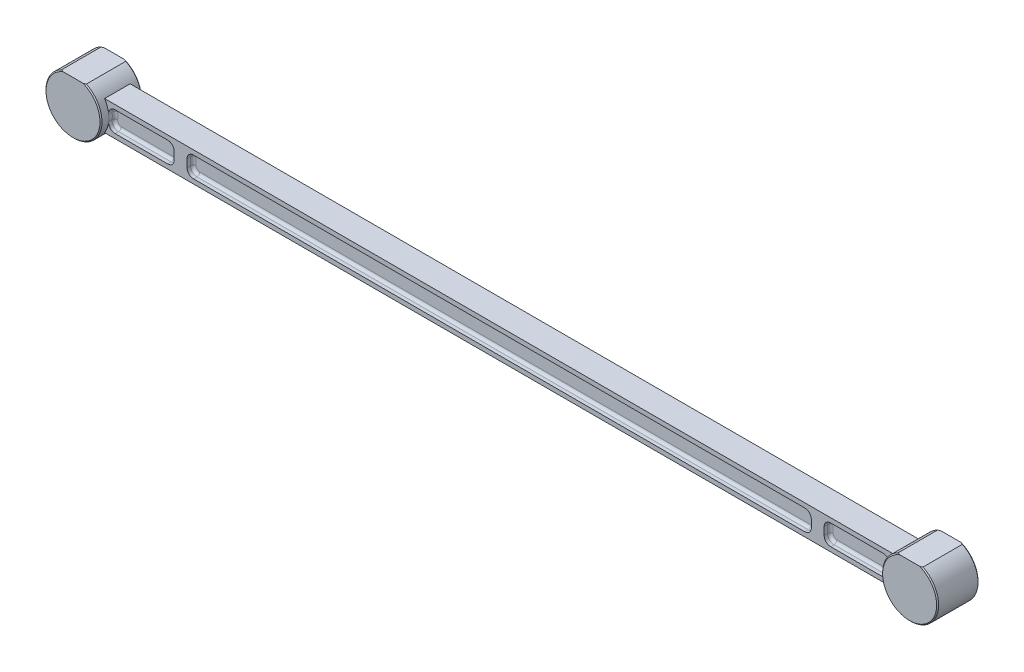
from build123d import *
from build123d.topology import SkipClean

# Parameters (mm, degrees)
EXTRUDE1_DEPTH      = 19.812
EXTRUDE1_DEPTH_BACK = 19.812
CUT_EXTRUDE1_DEPTH  = 9.652
CUT_EXTRUDE2_START  = -9.652
CUT_EXTRUDE2_DEPTH  = 9.652
EXTRUDE2_DEPTH      = 12.192
EXTRUDE2_DEPTH_BACK = 52.07
CHAMFER1_SIZE       = 1.524
FILLET1_R           = 4.318


with BuildPart() as part:
    # Sketch3 → Extrude1 (new, two sides: drawn at the far end of the back side and taken through both)
    with BuildSketch(Plane.XY.offset(-EXTRUDE1_DEPTH_BACK)):
        with BuildLine():
            Line((-19.262201877, 39.000001091), (19.262201877, 39.000001091))
            ThreePointArc((19.262201877, 39.000001091), (29.207695203, 32.232639469), (36.919270155, 22.999999944))
            Line((36.919270155, 22.999999944), (1263.080729845, 22.999999944))
            ThreePointArc((1263.080729845, 22.999999944), (1270.792304797, 32.232639469), (1280.737798123, 39.000001091))
            Line((1280.737798123, 39.000001091), (1319.262201877, 39.000001091))
            ThreePointArc((1319.262201877, 39.000001091), (1332.232639491, -29.207695179), (1263.080729879, -23))
            Line((1263.080729879, -23), (36.919270121, -23))
            ThreePointArc((36.919270121, -23), (-32.232639491, -29.207695179), (-19.262201877, 39.000001091))
        make_face()
    extrude(amount=EXTRUDE1_DEPTH + EXTRUDE1_DEPTH_BACK)

    # Sketch4 → Cut-Extrude1 (cut)
    with BuildSketch(Plane.XY.offset(19.812)):
        with BuildLine():
            Line((53.16249, 15.999999944), (134.999999965, 15.999999944))
            ThreePointArc((134.999999965, 15.999999944), (142.07106777, 13.071067778), (145, 6))
            Line((145, 6), (145, -6))
            ThreePointArc((145, -6), (142.071067812, -13.071067812), (135, -16))
            Line((135, -16), (53.16249, -16))
            ThreePointArc((53.16249, -16), (45.705450362, -12.662765822), (43.22557716, -4.878499573))
            ThreePointArc((43.22557716, -4.878499573), (43.500001722, 5.034e-06), (43.225576025, 4.878509576))
            ThreePointArc((43.225576025, 4.878509576), (45.705449579, 12.662773253), (53.16249, 15.999999944))
        make_face()
        with BuildLine():
            Line((165, 6), (165, -6))
            ThreePointArc((165, -6), (167.928932188, -13.071067812), (175, -16))
            Line((175, -16), (1124.999999965, -16))
            ThreePointArc((1124.999999965, -16), (1132.071067777, -13.071067812), (1134.999999965, -6))
            Line((1134.999999965, -6), (1134.999999965, 6))
            ThreePointArc((1134.999999965, 6), (1132.071067777, 13.071067812), (1124.999999965, 16))
            Line((1124.999999965, 16), (175, 16))
            ThreePointArc((175, 16), (167.928932188, 13.071067812), (165, 6))
        make_face()
        with BuildLine():
            Line((1164.999999965, -16), (1246.837509965, -16))
            ThreePointArc((1246.837509965, -16), (1254.294549604, -12.662765822), (1256.774422805, -4.878499573))
            ThreePointArc((1256.774422805, -4.878499573), (1256.499998243, 5.034e-06), (1256.774423941, 4.878509576))
            ThreePointArc((1256.774423941, 4.878509576), (1254.294550386, 12.662773253), (1246.837509965, 15.999999944))
            Line((1246.837509965, 15.999999944), (1165, 15.999999944))
            ThreePointArc((1165, 15.999999944), (1157.928932195, 13.071067778), (1154.999999965, 6))
            Line((1154.999999965, 6), (1154.999999965, -6))
            ThreePointArc((1154.999999965, -6), (1157.928932153, -13.071067812), (1164.999999965, -16))
        make_face()
    extrude(amount=-CUT_EXTRUDE1_DEPTH, mode=Mode.SUBTRACT)

    # Sketch5 → Cut-Extrude2 (cut)
    with BuildSketch(Plane(origin=(0, 0, -19.812), x_dir=(-1, 0, 0), z_dir=(0, 0, -1)).offset(CUT_EXTRUDE2_START)):
        with BuildLine():
            Line((-165, -6), (-165, 6))
            ThreePointArc((-165, 6), (-167.928932188, 13.071067812), (-175, 16))
            Line((-175, 16), (-1124.999999965, 16))
            ThreePointArc((-1124.999999965, 16), (-1132.071067777, 13.071067812), (-1134.999999965, 6))
            Line((-1134.999999965, 6), (-1134.999999965, -6))
            ThreePointArc((-1134.999999965, -6), (-1132.071067777, -13.071067812), (-1124.999999965, -16))
            Line((-1124.999999965, -16), (-175, -16))
            ThreePointArc((-175, -16), (-167.928932188, -13.071067812), (-165, -6))
        make_face()
        with BuildLine():
            Line((-1165, 15.999999944), (-1246.837509965, 15.999999944))
            ThreePointArc((-1246.837509965, 15.999999944), (-1254.294550386, 12.662773253), (-1256.774423941, 4.878509576))
            ThreePointArc((-1256.774423941, 4.878509576), (-1256.499998243, 5.034e-06), (-1256.774422805, -4.878499573))
            ThreePointArc((-1256.774422805, -4.878499573), (-1254.294549604, -12.662765822), (-1246.837509965, -16))
            Line((-1246.837509965, -16), (-1164.999999965, -16))
            ThreePointArc((-1164.999999965, -16), (-1157.928932153, -13.071067812), (-1154.999999965, -6))
            Line((-1154.999999965, -6), (-1154.999999965, 6))
            ThreePointArc((-1154.999999965, 6), (-1157.928932195, 13.071067778), (-1165, 15.999999944))
        make_face()
        with BuildLine():
            Line((-135, -16), (-53.16249, -16))
            ThreePointArc((-53.16249, -16), (-45.705450362, -12.662765822), (-43.22557716, -4.878499573))
            ThreePointArc((-43.22557716, -4.878499573), (-43.500001722, 5.034e-06), (-43.225576025, 4.878509576))
            ThreePointArc((-43.225576025, 4.878509576), (-45.705449579, 12.662773253), (-53.16249, 15.999999944))
            Line((-53.16249, 15.999999944), (-134.999999965, 15.999999944))
            ThreePointArc((-134.999999965, 15.999999944), (-142.07106777, 13.071067778), (-145, 6))
            Line((-145, 6), (-145, -6))
            ThreePointArc((-145, -6), (-142.071067812, -13.071067812), (-135, -16))
        make_face()
    extrude(amount=CUT_EXTRUDE2_DEPTH, mode=Mode.SUBTRACT)

    # Sketch6 → Extrude2 (add, two sides: drawn at the far end of the back side and taken through both)
    with SkipClean():  # the faces are left unmerged after this step: merging them gives an invalid solid
        with BuildSketch(Plane.XY.offset(19.812).offset(-EXTRUDE2_DEPTH_BACK)):
            with BuildLine():
                Line((1319.262201877, 39.000001091), (1280.737798123, 39.000001091))
                ThreePointArc((1280.737798123, 39.000001091), (1258.165929163, 11.913984366), (1263.080729879, -23))
                ThreePointArc((1263.080729879, -23), (1332.232639491, -29.207695179), (1319.262201877, 39.000001091))
            make_face()
            with BuildLine():
                Line((19.262201877, 39.000001091), (-19.262201877, 39.000001091))
                ThreePointArc((-19.262201877, 39.000001091), (-32.232639491, -29.207695179), (36.919270121, -23))
                ThreePointArc((36.919270121, -23), (41.834070837, 11.913984366), (19.262201877, 39.000001091))
            make_face()
        extrude(amount=EXTRUDE2_DEPTH + EXTRUDE2_DEPTH_BACK)
    add(part.part.scale(1), mode=Mode.REPLACE)  # the faces are merged on a copy

    # Chamfer1
    chamfer1_edges = [part.edges().sort_by_distance(p)[0] for p in [
        (0, -43.4975, -32.258),
        (0, -43.4975, 32.004),
        (1300, -43.4975, 32.004),
        (1300, -43.4975, -32.258),
    ]]
    chamfer(chamfer1_edges, length=CHAMFER1_SIZE)

    # Fillet1
    fillet1_edges = [part.edges().sort_by_distance(p)[0] for p in [
        (1157.928932153, -13.071067812, 10.16),
        (1154.999999965, 0, 10.16),
        (1205.918754965, -16, 10.16),
        (1157.928932195, 13.071067778, 10.16),
        (1254.294549604, -12.662765822, 10.16),
        (1205.918754983, 15.999999944, 10.16),
        (1256.499998243, 5.034e-06, 10.16),
        (1254.294550386, 12.662773253, 10.16),
        (43.500001722, 5.034e-06, 10.16),
        (45.705450362, -12.662765822, 10.16),
        (45.705449579, 12.662773253, 10.16),
        (94.081245, -16, 10.16),
        (94.081244983, 15.999999944, 10.16),
        (142.071067812, -13.071067812, 10.16),
        (142.07106777, 13.071067778, 10.16),
        (145, 0, 10.16),
        (1132.071067777, 13.071067812, 10.16),
        (1134.999999965, 0, 10.16),
        (649.999999983, 16, 10.16),
        (1132.071067777, -13.071067812, 10.16),
        (167.928932188, 13.071067812, 10.16),
        (649.999999983, -16, 10.16),
        (165, 0, 10.16),
        (167.928932188, -13.071067812, 10.16),
        (1205.918754983, 15.999999944, -10.16),
        (1157.928932195, 13.071067778, -10.16),
        (1254.294550386, 12.662773253, -10.16),
        (1154.999999965, 0, -10.16),
        (1256.499998243, 5.034e-06, -10.16),
        (1157.928932153, -13.071067812, -10.16),
        (1254.294549604, -12.662765822, -10.16),
        (1205.918754965, -16, -10.16),
        (94.081245, -16, -10.16),
        (142.071067812, -13.071067812, -10.16),
        (45.705450362, -12.662765822, -10.16),
        (145, 0, -10.16),
        (43.500001722, 5.034e-06, -10.16),
        (142.07106777, 13.071067778, -10.16),
        (45.705449579, 12.662773253, -10.16),
        (94.081244983, 15.999999944, -10.16),
        (1132.071067777, 13.071067812, -10.16),
        (649.999999983, 16, -10.16),
        (1134.999999965, 0, -10.16),
        (167.928932188, 13.071067812, -10.16),
        (1132.071067777, -13.071067812, -10.16),
        (165, 0, -10.16),
        (649.999999983, -16, -10.16),
        (167.928932188, -13.071067812, -10.16),
    ]]
    fillet(fillet1_edges, radius=FILLET1_R)


solid = part.part
